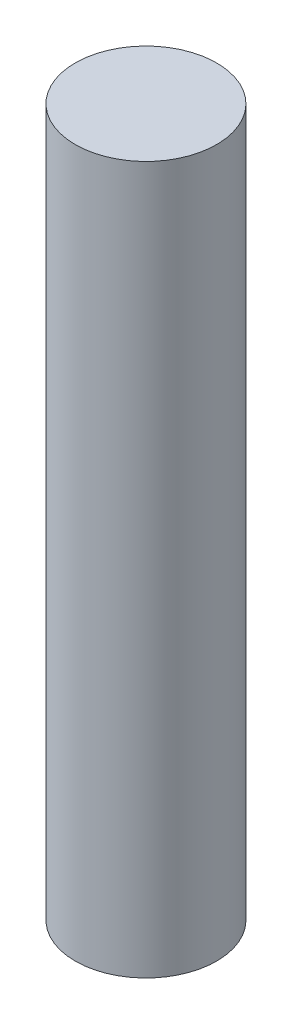
from build123d import *

# Parameters (mm, degrees)
SKETCH1_R           = 3.5
BOSS_EXTRUDE1_DEPTH = 35


with BuildPart() as part:
    # Sketch1 → Boss-Extrude1 (new body)
    with BuildSketch(Plane(origin=(0, 0, 0), x_dir=(1, 0, 0), z_dir=(0, 1, 0))):
        Circle(SKETCH1_R)
    extrude(amount=BOSS_EXTRUDE1_DEPTH)


solid = part.part
